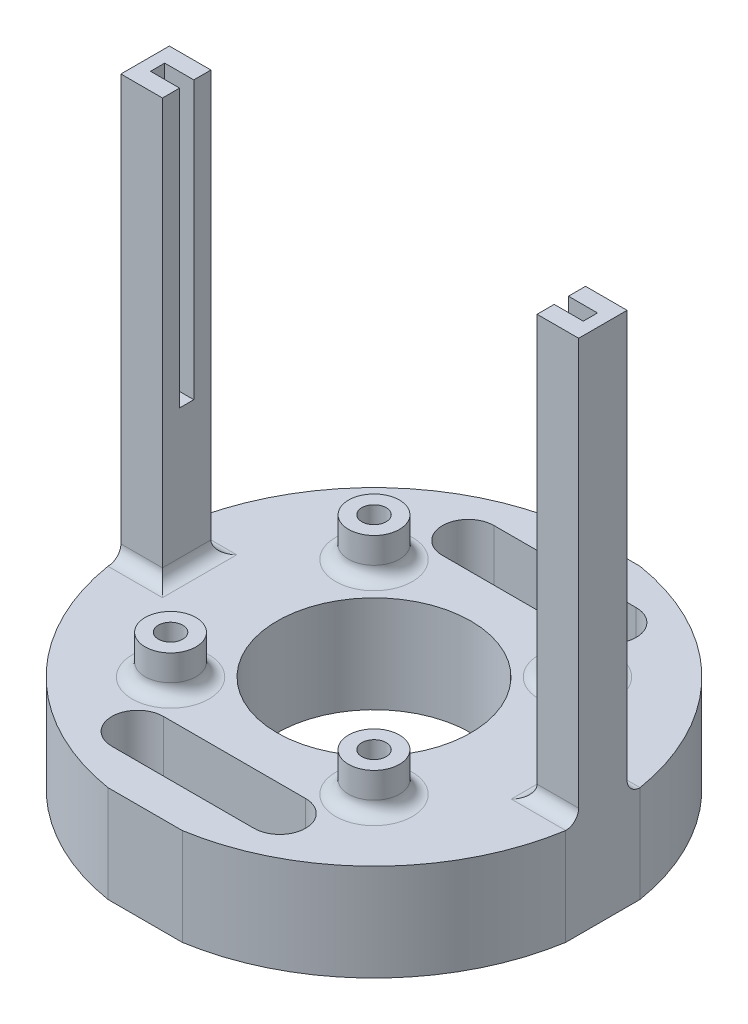
from build123d import *

# Parameters (mm, degrees)
SKETCH1_W           = 45
SKETCH1_H           = 45
BOSS_EXTRUDE1_DEPTH = 9.525
SKETCH2_R           = 2.5
BOSS_EXTRUDE2_DEPTH = 3.81
SKETCH3_W           = 4.085
SKETCH3_H           = 4.7625
BOSS_EXTRUDE3_DEPTH = 41.275
SKETCH4_W           = 42.545
SKETCH4_H           = 1.397
CUT_EXTRUDE1_DEPTH  = 27.2288
FILLET1_R           = 1.27
SKETCH5_R           = 1.2
CUT_EXTRUDE2_DEPTH  = 50.154106899
SKETCH6_R           = 9.525
CUT_EXTRUDE3_DEPTH  = 53.116462131
CUT_EXTRUDE4_DEPTH  = 53.116462131
CUT_EXTRUDE5_DEPTH  = 53.116462131


with BuildPart() as part:
    # Sketch1 → Boss-Extrude1 (new body)
    with BuildSketch(Plane(origin=(0, 0, 0), x_dir=(1, 0, 0), z_dir=(0, 1, 0))):
        Rectangle(SKETCH1_W, SKETCH1_H)
    extrude(amount=-BOSS_EXTRUDE1_DEPTH)

    # Sketch2 → Boss-Extrude2 (add)
    with BuildSketch(Plane(origin=(0, 0, 0), x_dir=(1, 0, 0), z_dir=(0, 1, 0))):
        with Locations((-10, 10)):
            Circle(SKETCH2_R)
        with Locations((10, 10)):
            Circle(SKETCH2_R)
        with Locations((10, -10)):
            Circle(SKETCH2_R)
        with Locations((-10, -10)):
            Circle(SKETCH2_R)
    extrude(amount=BOSS_EXTRUDE2_DEPTH)

    # Sketch3 → Boss-Extrude3 (add)
    with BuildSketch(Plane(origin=(0, 0, 0), x_dir=(1, 0, 0), z_dir=(0, 1, 0))):
        with Locations((-20.4575, 0)):
            Rectangle(SKETCH3_W, SKETCH3_H)
        with Locations((20.4575, 0)):
            Rectangle(SKETCH3_W, SKETCH3_H)
    extrude(amount=BOSS_EXTRUDE3_DEPTH)

    # Sketch4 → Cut-Extrude1 (cut)
    with BuildSketch(Plane(origin=(0, 41.275, 0), x_dir=(1, 0, 0), z_dir=(0, 1, 0))):
        Rectangle(SKETCH4_W, SKETCH4_H)
    extrude(amount=-CUT_EXTRUDE1_DEPTH, mode=Mode.SUBTRACT)

    # Fillet1
    fillet1_edges = [part.edges().sort_by_distance(p)[0] for p in [
        (-12.5, 0, -10),
        (7.5, 0, -10),
        (7.5, 0, 10),
        (-12.5, 0, 10),
        (18.415, 0, 0),
        (20.4575, 0, -2.38125),
        (20.4575, 0, 2.38125),
        (-20.4575, 0, -2.38125),
        (-20.4575, 0, 2.38125),
        (-18.415, 0, 0),
    ]]
    fillet(fillet1_edges, radius=FILLET1_R)

    # Sketch5 → Cut-Extrude2 (cut, through all)
    with BuildSketch(Plane(origin=(0, 3.81, 0), x_dir=(1, 0, 0), z_dir=(0, 1, 0))):
        with Locations((-10, 10)):
            Circle(SKETCH5_R)
        with Locations((10, 10)):
            Circle(SKETCH5_R)
        with Locations((10, -10)):
            Circle(SKETCH5_R)
        with Locations((-10, -10)):
            Circle(SKETCH5_R)
    extrude(amount=-CUT_EXTRUDE2_DEPTH, mode=Mode.SUBTRACT)

    # Sketch6 → Cut-Extrude3 (cut, through all)
    with BuildSketch(Plane(origin=(0, 0, 0), x_dir=(1, 0, 0), z_dir=(0, 1, 0))):
        Circle(SKETCH6_R)
    extrude(amount=-CUT_EXTRUDE3_DEPTH, mode=Mode.SUBTRACT)

    # Sketch7 → Cut-Extrude4 (cut, through all)
    with BuildSketch(Plane(origin=(0, 0, 0), x_dir=(1, 0, 0), z_dir=(0, 1, 0))):
        with BuildLine():
            Line((-3.65125, 22.5), (-22.5, 22.5))
            Line((-22.5, 22.5), (-22.5, 3.65125))
            ThreePointArc((-22.5, 3.65125), (-16.118027587, 16.118027587), (-3.65125, 22.5))
        make_face()
        with BuildLine():
            Line((3.65125, -22.5), (22.5, -22.5))
            Line((22.5, -22.5), (22.5, -3.65125))
            ThreePointArc((22.5, -3.65125), (16.118027587, -16.118027587), (3.65125, -22.5))
        make_face()
        with BuildLine():
            Line((22.5, 3.65125), (22.5, 22.5))
            Line((22.5, 22.5), (3.65125, 22.5))
            ThreePointArc((3.65125, 22.5), (16.118027587, 16.118027587), (22.5, 3.65125))
        make_face()
        with BuildLine():
            Line((-22.5, -3.65125), (-22.5, -22.5))
            Line((-22.5, -22.5), (-3.65125, -22.5))
            ThreePointArc((-3.65125, -22.5), (-16.118027587, -16.118027587), (-22.5, -3.65125))
        make_face()
    extrude(amount=-CUT_EXTRUDE4_DEPTH, mode=Mode.SUBTRACT)

    # Sketch9 → Cut-Extrude5 (cut, through all)
    with BuildSketch(Plane(origin=(0, 0, 0), x_dir=(1, 0, 0), z_dir=(0, 1, 0))):
        with BuildLine():
            Line((-6.985, -13.71), (6.985, -13.71))
            ThreePointArc((6.985, -13.71), (9.525, -16.25), (6.985, -18.79))
            Line((6.985, -18.79), (-6.985, -18.79))
            ThreePointArc((-6.985, -18.79), (-9.525, -16.25), (-6.985, -13.71))
        make_face()
        with BuildLine():
            Line((-6.985, 13.71), (6.985, 13.71))
            ThreePointArc((6.985, 13.71), (9.525, 16.25), (6.985, 18.79))
            Line((6.985, 18.79), (-6.985, 18.79))
            ThreePointArc((-6.985, 18.79), (-9.525, 16.25), (-6.985, 13.71))
        make_face()
    extrude(amount=-CUT_EXTRUDE5_DEPTH, mode=Mode.SUBTRACT)


solid = part.part
